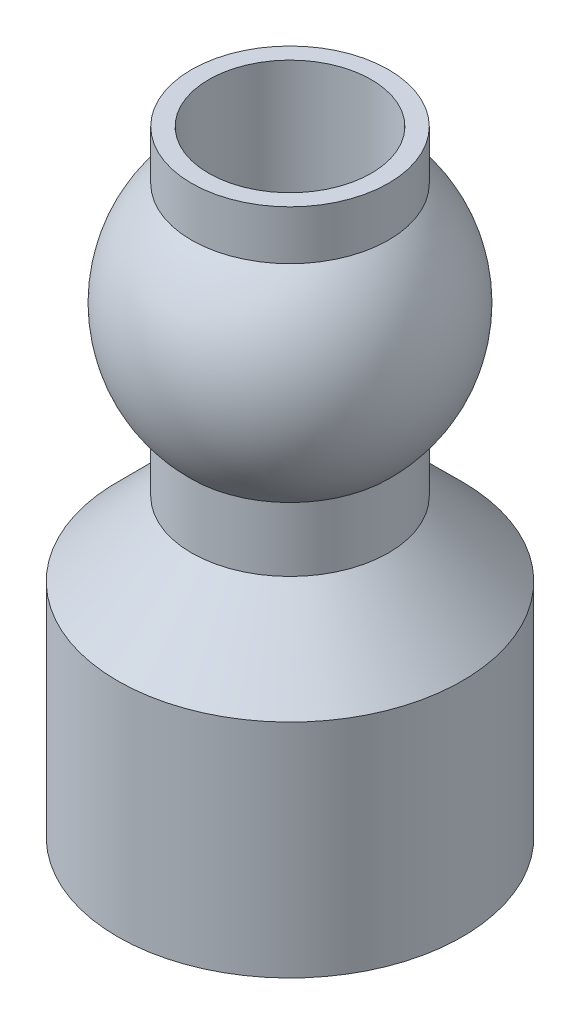
from build123d import *

# Parameters (mm, degrees)
SKETCH2_R          = 1.65
CUT_EXTRUDE1_DEPTH = 12.5


with BuildPart() as part:
    # Sketch1 → Revolve1 (revolve)
    with BuildSketch(Plane.XY):
        with BuildLine():
            Line((0, 6.25), (0, -6.25))
            Line((0, -6.25), (3.5, -6.25))
            Line((3.5, -6.25), (3.5, -1.75))
            Line((3.5, -1.75), (2, -0.25))
            Line((2, -0.25), (2, 1.05))
            ThreePointArc((2, 1.05), (2.9, 3.15), (2, 5.25))
            Line((2, 5.25), (2, 6.25))
            Line((2, 6.25), (0, 6.25))
        make_face()
    revolve(axis=Axis((0, 9.816629846, 0), (0, -1, 0)))

    # Sketch2 → Cut-Extrude1 (cut)
    with BuildSketch(Plane(origin=(0, 6.25, 0), x_dir=(1, 0, 0), z_dir=(0, 1, 0))):
        Circle(SKETCH2_R)
    extrude(amount=-CUT_EXTRUDE1_DEPTH, mode=Mode.SUBTRACT)


solid = part.part
